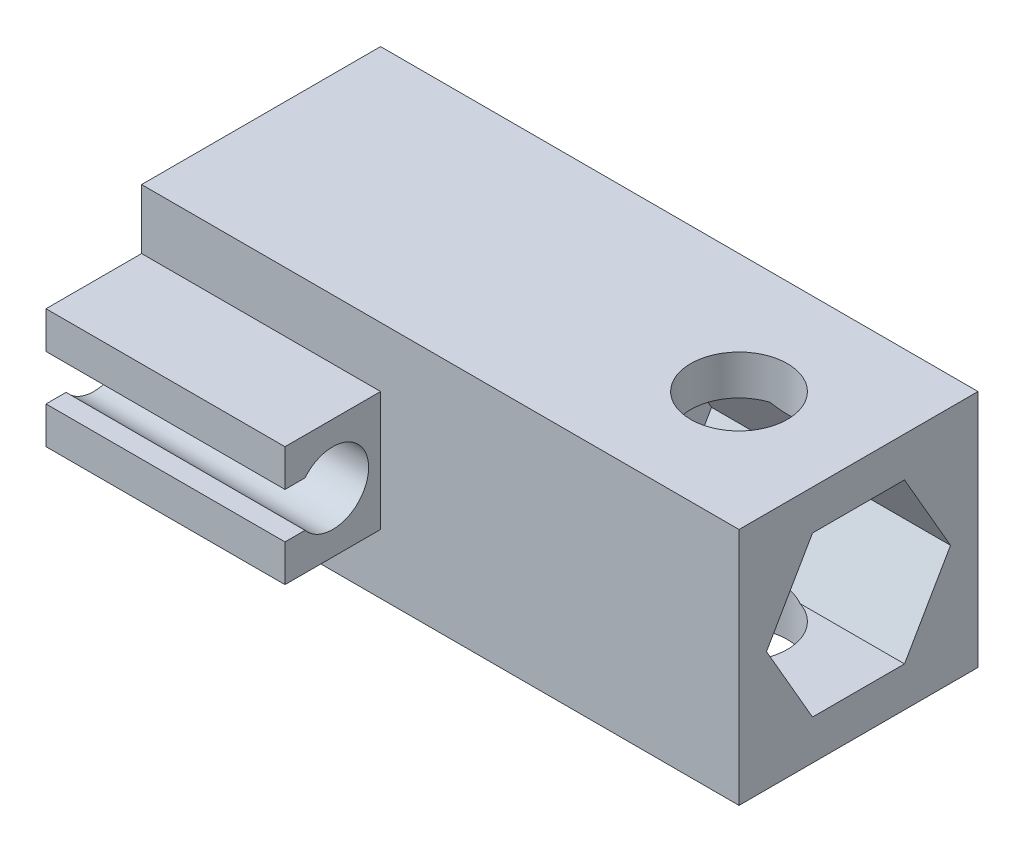
from build123d import *

# Parameters (mm, degrees)
SKETCH1_W           = 50
SKETCH1_H           = 20
SKETCH1_R           = 4.05
BOSS_EXTRUDE1_DEPTH = 20
SKETCH2_R           = 4.1
CUT_EXTRUDE1_DEPTH  = 55.772255751
CUT_EXTRUDE2_DEPTH  = 20
BOSS_EXTRUDE3_DEPTH = 20


with BuildPart() as part:
    # Sketch1 → Boss-Extrude1 (new body)
    with BuildSketch(Plane(origin=(0, 0, 0), x_dir=(1, 0, 0), z_dir=(0, 1, 0))):
        Rectangle(SKETCH1_W, SKETCH1_H)
        with Locations((15, 0)):
            Circle(SKETCH1_R, mode=Mode.SUBTRACT)
    extrude(amount=BOSS_EXTRUDE1_DEPTH)

    # Sketch2 → Cut-Extrude1 (cut, through all)
    with BuildSketch(Plane.ZY.offset(25)):
        with Locations((0, 10)):
            Circle(SKETCH2_R)
    extrude(amount=-CUT_EXTRUDE1_DEPTH, mode=Mode.SUBTRACT)

    # Sketch3 → Cut-Extrude2 (cut)
    with BuildSketch(Plane(origin=(25, 0, 0), x_dir=(0, 0, -1), z_dir=(1, 0, 0))):
        Polygon((-3.85, 16.668395609), (-7.7, 10), (-3.85, 3.331604391), (3.85, 3.331604391), (7.7, 10), (3.85, 16.668395609), align=None)
    extrude(amount=-CUT_EXTRUDE2_DEPTH, mode=Mode.SUBTRACT)

    # Sketch8 → Boss-Extrude3 (add)
    with BuildSketch(Plane.ZY.offset(25)):
        with BuildLine():
            Line((18, 15), (18, 11.9))
            Line((18, 11.9), (16.321637353, 11.9))
            ThreePointArc((16.321637353, 11.9), (11, 10), (16.321637353, 8.1))
            Line((16.321637353, 8.1), (18, 8.1))
            Line((18, 8.1), (18, 5))
            Line((18, 5), (10, 5))
            Line((10, 5), (10, 15))
            Line((10, 15), (18, 15))
        make_face()
    extrude(amount=-BOSS_EXTRUDE3_DEPTH)


solid = part.part
